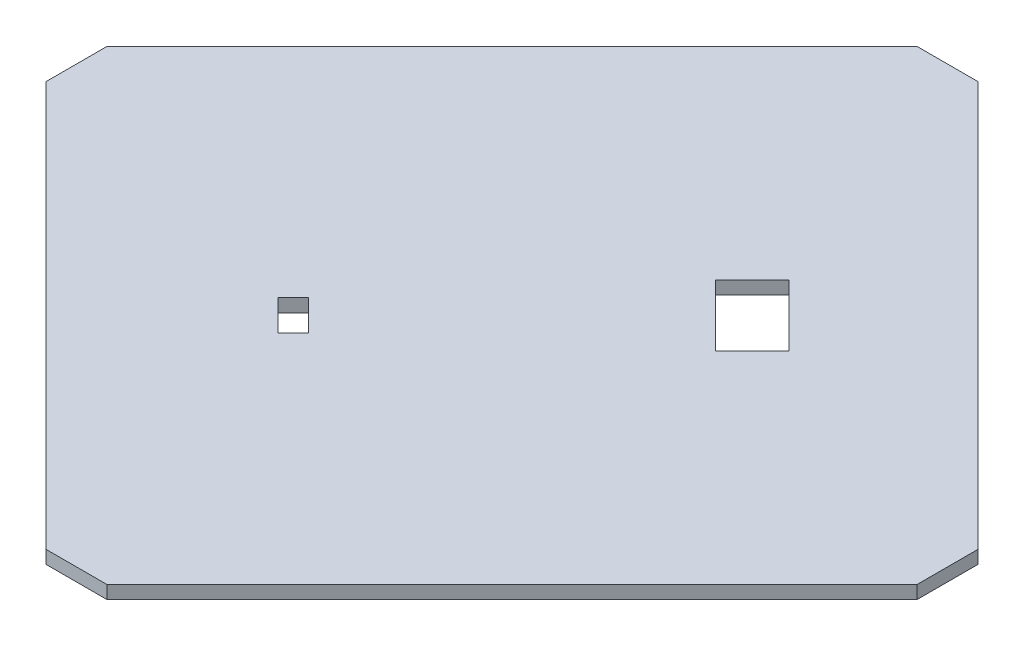
from build123d import *

# Parameters (mm, degrees)
MAIN_PLATE_DEPTH               = 3
BOTTOM_PLATE_CONNECTORS_DEPTH  = 22
REMOVE_STRESS_CONCENTRATIONS_R = 2.5
WIRE_HOLES_DEPTH               = 144.122325303


with BuildPart() as part:
    # Sketch1 → Main Plate (new body)
    with BuildSketch(Plane(origin=(0, 0, 0), x_dir=(1, 0, 0), z_dir=(0, 1, 0))):
        Polygon((-7, 100), (7, 100), (100, 7), (100, -7), (7, -100), (-7, -100), (-100, -7), (-100, 7), align=None)
    extrude(amount=MAIN_PLATE_DEPTH)

    # Sketch2 → Bottom Plate Connectors (add)
    with BuildSketch(Plane.XZ):
        Polygon((8.838834765, 15.909902577), (15.909902577, 8.838834765), (18.03122292, 10.960155108), (10.960155108, 18.03122292), align=None)
        Polygon((15.909902577, -8.838834765), (8.838834765, -15.909902577), (10.960155108, -18.03122292), (18.03122292, -10.960155108), align=None)
        Polygon((-8.838834765, -15.909902577), (-15.909902577, -8.838834765), (-18.03122292, -10.960155108), (-10.960155108, -18.03122292), align=None)
        Polygon((-15.909902577, 8.838834765), (-8.838834765, 15.909902577), (-10.960155108, 18.03122292), (-18.03122292, 10.960155108), align=None)
    extrude(amount=BOTTOM_PLATE_CONNECTORS_DEPTH)

    # Remove Stress Concentrations
    remove_stress_concentrations_edges = [part.edges().sort_by_distance(p)[0] for p in [
        (-14.495689014, 0, -14.495689014),
        (-16.970562748, 0, -9.899494937),
        (-16.970562748, 0, 9.899494937),
        (9.899494937, 0, 16.970562748),
        (-14.495689014, 0, 14.495689014),
        (-9.899494937, 0, 16.970562748),
        (14.495689014, 0, 14.495689014),
        (16.970562748, 0, -9.899494937),
        (16.970562748, 0, 9.899494937),
        (-9.899494937, 0, -16.970562748),
        (14.495689014, 0, -14.495689014),
        (9.899494937, 0, -16.970562748),
    ]]
    fillet(remove_stress_concentrations_edges, radius=REMOVE_STRESS_CONCENTRATIONS_R)

    # Sketch3 → Wire Holes (cut, through all)
    with BuildSketch(Plane.XZ):
        Polygon((30.405591591, -16.263455967), (38.890872965, -24.748737342), (24.748737342, -38.890872965), (16.263455967, -30.405591591), align=None)
        Polygon((-23.334523779, 30.405591591), (-19.798989873, 26.870057685), (-26.870057685, 19.798989873), (-30.405591591, 23.334523779), align=None)
    extrude(amount=-WIRE_HOLES_DEPTH, mode=Mode.SUBTRACT)


solid = part.part
